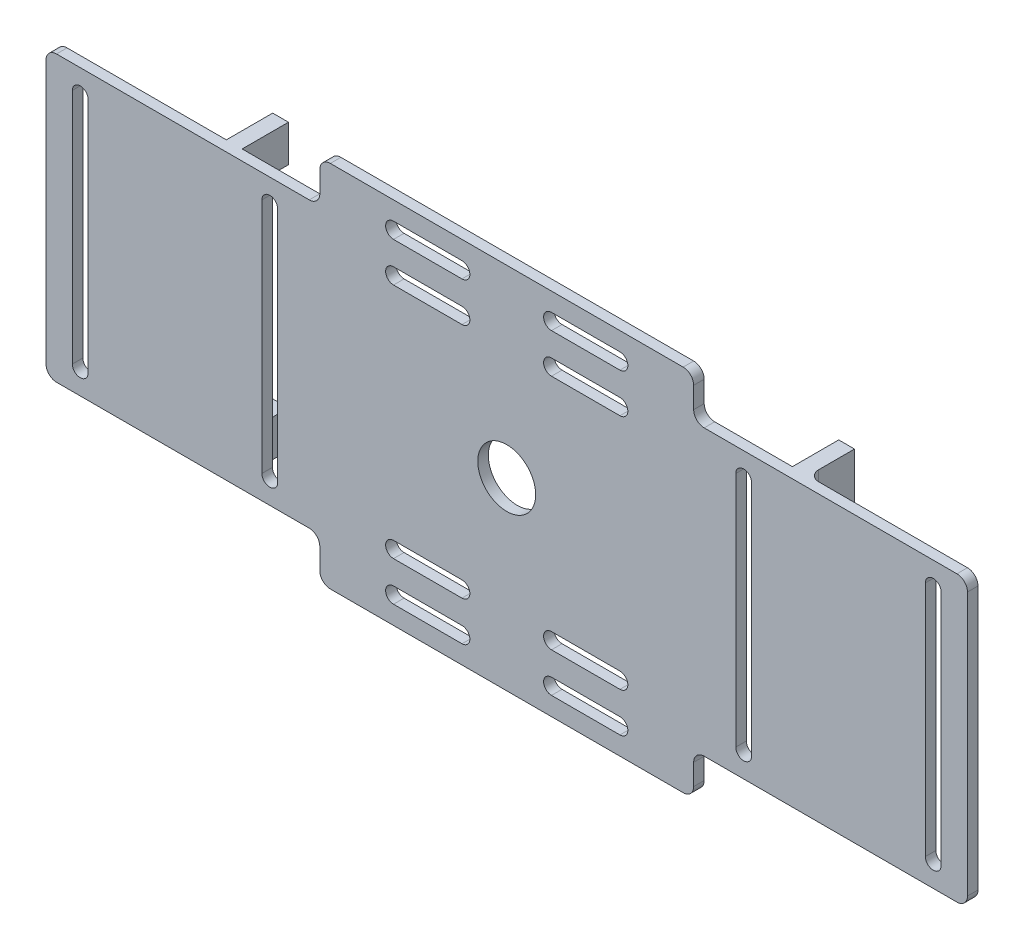
from build123d import *

# Parameters (mm, degrees)
EXTRUDE_1_DEPTH     = 2
SKETCH_2_R          = 5.5
CUT_EXTRUDE_1_DEPTH = 95.26160406
SKETCH_5_W          = 3
SKETCH_5_H          = 54
EXTRUDE_2_DEPTH     = 10.8
FILLET_1_R          = 2
SKETCH_6_W          = 3
SKETCH_6_H          = 40
CUT_EXTRUDE_3_DEPTH = 6
FILLET_2_R          = 2


with BuildPart() as part:
    # 草圖1 → 填料-伸長1 (new body)
    with BuildSketch(Plane.XY):
        with BuildLine():
            Line((35.5, 33), (35.5, 29))
            ThreePointArc((35.5, 29), (36.085786438, 27.585786438), (37.5, 27))
            Line((37.5, 27), (85.5, 27))
            ThreePointArc((85.5, 27), (86.914213562, 26.414213562), (87.5, 25))
            Line((87.5, 25), (87.5, -25))
            ThreePointArc((87.5, -25), (86.914213562, -26.414213562), (85.5, -27))
            Line((85.5, -27), (37.5, -27))
            ThreePointArc((37.5, -27), (36.085786438, -27.585786438), (35.5, -29))
            Line((35.5, -29), (35.5, -33))
            ThreePointArc((35.5, -33), (34.914213562, -34.414213562), (33.5, -35))
            Line((33.5, -35), (-33.5, -35))
            ThreePointArc((-33.5, -35), (-34.914213562, -34.414213562), (-35.5, -33))
            Line((-35.5, -33), (-35.5, -29))
            ThreePointArc((-35.5, -29), (-36.085786438, -27.585786438), (-37.5, -27))
            Line((-37.5, -27), (-85.5, -27))
            ThreePointArc((-85.5, -27), (-86.914213562, -26.414213562), (-87.5, -25))
            Line((-87.5, -25), (-87.5, 25))
            ThreePointArc((-87.5, 25), (-86.914213562, 26.414213562), (-85.5, 27))
            Line((-85.5, 27), (-37.5, 27))
            ThreePointArc((-37.5, 27), (-36.085786438, 27.585786438), (-35.5, 29))
            Line((-35.5, 29), (-35.5, 33))
            ThreePointArc((-35.5, 33), (-34.914213562, 34.414213562), (-33.5, 35))
            Line((-33.5, 35), (33.5, 35))
            ThreePointArc((33.5, 35), (34.914213562, 34.414213562), (35.5, 33))
        make_face()
    extrude(amount=EXTRUDE_1_DEPTH)

    # 草圖2 → 除料-伸長1 (cut, through all)
    with BuildSketch(Plane.XY.offset(2)):
        Circle(SKETCH_2_R)
        with BuildLine():
            Line((43.5, -22.5), (43.5, 22.5))
            ThreePointArc((43.5, 22.5), (45, 24), (46.5, 22.5))
            Line((46.5, 22.5), (46.5, -22.5))
            ThreePointArc((46.5, -22.5), (45, -24), (43.5, -22.5))
        make_face()
        with BuildLine():
            Line((-46.5, -22.5), (-46.5, 22.5))
            ThreePointArc((-46.5, 22.5), (-45, 24), (-43.5, 22.5))
            Line((-43.5, 22.5), (-43.5, -22.5))
            ThreePointArc((-43.5, -22.5), (-45, -24), (-46.5, -22.5))
        make_face()
        with BuildLine():
            Line((21.5, 28.5), (8.5, 28.5))
            ThreePointArc((8.5, 28.5), (7, 30), (8.5, 31.5))
            Line((8.5, 31.5), (21.5, 31.5))
            ThreePointArc((21.5, 31.5), (23, 30), (21.5, 28.5))
        make_face()
        with BuildLine():
            Line((-82.5, -22.5), (-82.5, 22.5))
            ThreePointArc((-82.5, 22.5), (-81, 24), (-79.5, 22.5))
            Line((-79.5, 22.5), (-79.5, -22.5))
            ThreePointArc((-79.5, -22.5), (-81, -24), (-82.5, -22.5))
        make_face()
        with BuildLine():
            Line((79.5, -22.5), (79.5, 22.5))
            ThreePointArc((79.5, 22.5), (81, 24), (82.5, 22.5))
            Line((82.5, 22.5), (82.5, -22.5))
            ThreePointArc((82.5, -22.5), (81, -24), (79.5, -22.5))
        make_face()
        with BuildLine():
            Line((21.5, 21), (8.5, 21))
            ThreePointArc((8.5, 21), (7, 22.5), (8.5, 24))
            Line((8.5, 24), (21.5, 24))
            ThreePointArc((21.5, 24), (23, 22.5), (21.5, 21))
        make_face()
        with BuildLine():
            Line((-21.5, 28.5), (-8.5, 28.5))
            ThreePointArc((-8.5, 28.5), (-7, 30), (-8.5, 31.5))
            Line((-8.5, 31.5), (-21.5, 31.5))
            ThreePointArc((-21.5, 31.5), (-23, 30), (-21.5, 28.5))
        make_face()
        with BuildLine():
            Line((-21.5, 21), (-8.5, 21))
            ThreePointArc((-8.5, 21), (-7, 22.5), (-8.5, 24))
            Line((-8.5, 24), (-21.5, 24))
            ThreePointArc((-21.5, 24), (-23, 22.5), (-21.5, 21))
        make_face()
        with BuildLine():
            Line((21.5, -28.5), (8.5, -28.5))
            ThreePointArc((8.5, -28.5), (7, -30), (8.5, -31.5))
            Line((8.5, -31.5), (21.5, -31.5))
            ThreePointArc((21.5, -31.5), (23, -30), (21.5, -28.5))
        make_face()
        with BuildLine():
            Line((21.5, -21), (8.5, -21))
            ThreePointArc((8.5, -21), (7, -22.5), (8.5, -24))
            Line((8.5, -24), (21.5, -24))
            ThreePointArc((21.5, -24), (23, -22.5), (21.5, -21))
        make_face()
        with BuildLine():
            Line((-21.5, -28.5), (-8.5, -28.5))
            ThreePointArc((-8.5, -28.5), (-7, -30), (-8.5, -31.5))
            Line((-8.5, -31.5), (-21.5, -31.5))
            ThreePointArc((-21.5, -31.5), (-23, -30), (-21.5, -28.5))
        make_face()
        with BuildLine():
            Line((-21.5, -21), (-8.5, -21))
            ThreePointArc((-8.5, -21), (-7, -22.5), (-8.5, -24))
            Line((-8.5, -24), (-21.5, -24))
            ThreePointArc((-21.5, -24), (-23, -22.5), (-21.5, -21))
        make_face()
    extrude(amount=-CUT_EXTRUDE_1_DEPTH, mode=Mode.SUBTRACT)

    # 草圖5 → 填料-伸長2 (add)
    with BuildSketch(Plane.XY.offset(2)):
        with Locations((-53.75, 0)):
            Rectangle(SKETCH_5_W, SKETCH_5_H)
        with Locations((53.75, 0)):
            Rectangle(SKETCH_5_W, SKETCH_5_H)
    extrude(amount=-EXTRUDE_2_DEPTH)

    # 圓角1
    fillet_1_edges = [part.edges().sort_by_distance(p)[0] for p in [
        (55.25, 0, 0),
    ]]
    fillet(fillet_1_edges, radius=FILLET_1_R)

    # 草圖6 → 除料-伸長3 (cut)
    with BuildSketch(Plane(origin=(0, 0, -8.8), x_dir=(-1, 0, 0), z_dir=(0, 0, -1))):
        with Locations((53.75, 0)):
            Rectangle(SKETCH_6_W, SKETCH_6_H)
    extrude(amount=-CUT_EXTRUDE_3_DEPTH, mode=Mode.SUBTRACT)

    # 圓角2
    fillet_2_edges = [part.edges().sort_by_distance(p)[0] for p in [
        (-53.75, -20, -2.8),
        (-53.75, 20, -2.8),
    ]]
    fillet(fillet_2_edges, radius=FILLET_2_R)


solid = part.part
